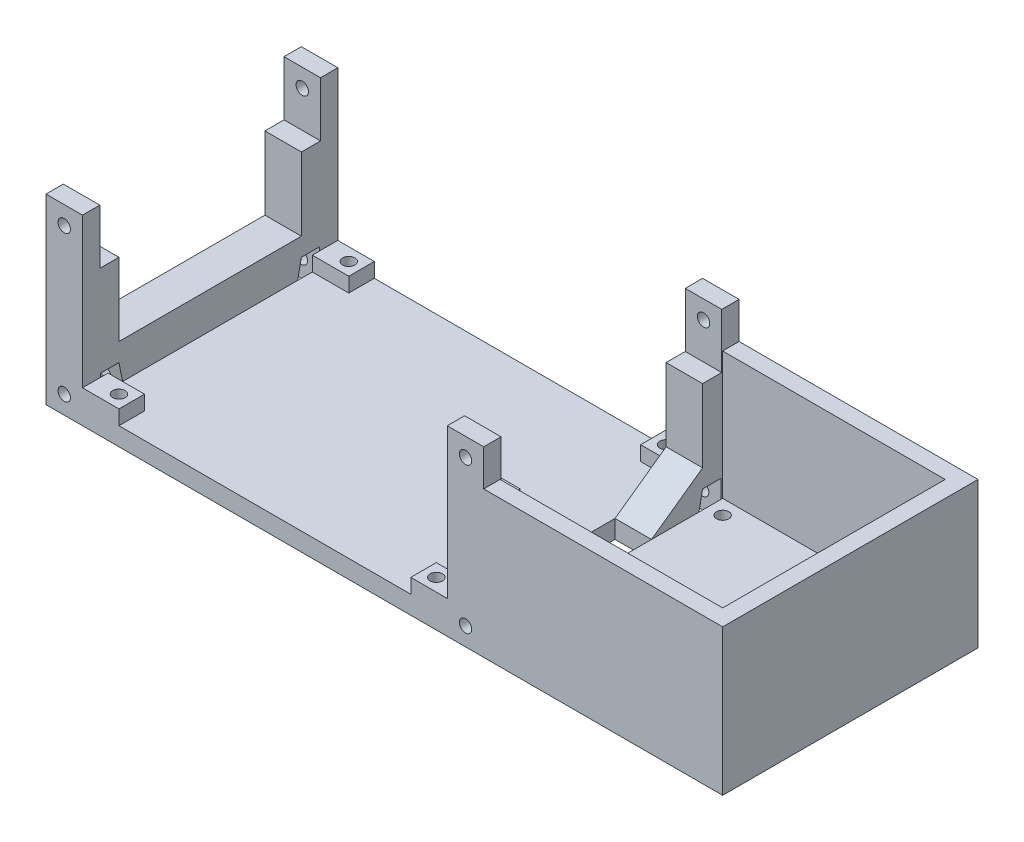
from build123d import *
from OCP.BRepFilletAPI import BRepFilletAPI_MakeChamfer

# Parameters (mm, degrees)
SKETCH1_W                = 120
SKETCH1_H                = 70
BOSS_EXTRUDE1_DEPTH      = 5
SKETCH4_W                = 10
SKETCH4_H                = 10
BOSS_EXTRUDE2_DEPTH      = 30
SKETCH5_W                = 10
SKETCH5_H                = 5
CUT_EXTRUDE2_DEPTH       = 10
SKETCH8_W                = 10
SKETCH8_H                = 7
BOSS_EXTRUDE5_DEPTH      = 4
M3_CLEARANCE_HOLE2_D     = 3.4
M3_CLEARANCE_HOLE2_DEPTH = 65
M3_CLEARANCE_HOLE2_TIP   = 1.021463052
SKETCH12_W               = 65.5
SKETCH12_H               = 70
BOSS_EXTRUDE6_DEPTH      = 5
BOSS_EXTRUDE7_DEPTH      = 35
M3_CLEARANCE_HOLE3_D     = 3.4
M3_CLEARANCE_HOLE3_DEPTH = 65
M3_CLEARANCE_HOLE3_TIP   = 1.021463052
SKETCH24_W               = 10
SKETCH24_H               = 50
BOSS_EXTRUDE10_DEPTH     = 10
SKETCH16_W               = 10
SKETCH16_H               = 22
CUT_EXTRUDE5_DEPTH       = 133.665933834
SKETCH22_R               = 1.7
CUT_EXTRUDE7_DEPTH       = 20
CHAMFER2_SIZE            = 10
CHAMFER2_SIZE_2          = 14
SKETCH25_W               = 5.49
SKETCH25_H               = 3
CUT_EXTRUDE8_DEPTH       = 8
CUT_EXTRUDE9_START       = -20
SKETCH26_R               = 1.7
CUT_EXTRUDE9_DEPTH       = 20
CUT_EXTRUDE11_DEPTH      = 10
LPATTERN1_COUNT          = 2
LPATTERN1_PITCH          = 110
SKETCH29_W               = 10
SKETCH29_H               = 4.75
BOSS_EXTRUDE11_DEPTH     = 15
SKETCH31_R               = 1.7
CUT_EXTRUDE13_DEPTH      = 153.152062096


with BuildPart() as part:
    # Sketch1 → Boss-Extrude1 (new body)
    with BuildSketch(Plane(origin=(0, 0, 0), x_dir=(1, 0, 0), z_dir=(0, 1, 0))):
        Rectangle(SKETCH1_W, SKETCH1_H)
    extrude(amount=BOSS_EXTRUDE1_DEPTH)

    # Sketch4 → Boss-Extrude2 (add)
    with BuildSketch(Plane(origin=(0, 5, 0), x_dir=(1, 0, 0), z_dir=(0, 1, 0))):
        with Locations((-55, -30)):
            Rectangle(SKETCH4_W, SKETCH4_H)
        with Locations((-55, 30)):
            Rectangle(SKETCH4_W, SKETCH4_H)
        with Locations((55, -30)):
            Rectangle(SKETCH4_W, SKETCH4_H)
        with Locations((55, 30)):
            Rectangle(SKETCH4_W, SKETCH4_H)
    extrude(amount=BOSS_EXTRUDE2_DEPTH)

    # Sketch5 → Cut-Extrude2 (cut)
    with BuildSketch(Plane.XZ):
        with Locations((-55, -27.5)):
            Rectangle(SKETCH5_W, SKETCH5_H)
        with Locations((-55, 27.5)):
            Rectangle(SKETCH5_W, SKETCH5_H)
        with Locations((55, 27.5)):
            Rectangle(SKETCH5_W, SKETCH5_H)
        with Locations((55, -27.5)):
            Rectangle(SKETCH5_W, SKETCH5_H)
    extrude(amount=-CUT_EXTRUDE2_DEPTH, mode=Mode.SUBTRACT)

    # Sketch8 → Boss-Extrude5 (add)
    with BuildSketch(Plane(origin=(0, 5, 0), x_dir=(1, 0, 0), z_dir=(0, 1, 0))):
        with Locations((-45, 31.5)):
            Rectangle(SKETCH8_W, SKETCH8_H)
        with Locations((-45, -31.5)):
            Rectangle(SKETCH8_W, SKETCH8_H)
        with Locations((45, -31.5)):
            Rectangle(SKETCH8_W, SKETCH8_H)
        with Locations((45, 31.5)):
            Rectangle(SKETCH8_W, SKETCH8_H)
    extrude(amount=BOSS_EXTRUDE5_DEPTH)

    # M3 Clearance Hole2
    with Locations(Plane(origin=(0, 9, 0), x_dir=(1, 0, 0), z_dir=(0, 1, 0))):
        with Locations((-43.5, -31.5), (-43.5, 31.5), (43.5, 31.5), (43.5, -31.5)):
            Hole(M3_CLEARANCE_HOLE2_D / 2, depth=M3_CLEARANCE_HOLE2_DEPTH)
            with Locations((0, 0, -(M3_CLEARANCE_HOLE2_DEPTH + M3_CLEARANCE_HOLE2_TIP / 2))):  # 118° drill point
                Cone(0, M3_CLEARANCE_HOLE2_D / 2, M3_CLEARANCE_HOLE2_TIP, mode=Mode.SUBTRACT)

    # Sketch12 → Boss-Extrude6 (add)
    with BuildSketch(Plane.XZ):
        with Locations((92.75, 0)):
            Rectangle(SKETCH12_W, SKETCH12_H)
    extrude(amount=-BOSS_EXTRUDE6_DEPTH)

    # Sketch13 → Boss-Extrude7 (add)
    with BuildSketch(Plane(origin=(0, 5, 0), x_dir=(1, 0, 0), z_dir=(0, 1, 0))):
        Polygon((60, 35), (125.5, 35), (125.5, -35), (60, -35), (60, -30.5), (121, -30.5), (121, 30.5), (60, 30.5), align=None)
    extrude(amount=BOSS_EXTRUDE7_DEPTH)

    # M3 Clearance Hole3
    with Locations(Plane(origin=(0, 5, 0), x_dir=(1, 0, 0), z_dir=(0, 1, 0))):
        with Locations((117, -26.5), (117, 26.5), (64, 26.5), (64, -26.5)):
            Hole(M3_CLEARANCE_HOLE3_D / 2, depth=M3_CLEARANCE_HOLE3_DEPTH)
            with Locations((0, 0, -(M3_CLEARANCE_HOLE3_DEPTH + M3_CLEARANCE_HOLE3_TIP / 2))):  # 118° drill point
                Cone(0, M3_CLEARANCE_HOLE3_D / 2, M3_CLEARANCE_HOLE3_TIP, mode=Mode.SUBTRACT)

    # Sketch24 → Boss-Extrude10 (add)
    with BuildSketch(Plane(origin=(0, 5, 0), x_dir=(1, 0, 0), z_dir=(0, 1, 0))):
        with Locations((-55, 0)):
            Rectangle(SKETCH24_W, SKETCH24_H)
        with Locations((55, 0)):
            Rectangle(SKETCH24_W, SKETCH24_H)
    extrude(amount=BOSS_EXTRUDE10_DEPTH)

    # Sketch16 → Cut-Extrude5 (cut, through all)
    with BuildSketch(Plane(origin=(0, 15, 0), x_dir=(1, 0, 0), z_dir=(0, 1, 0))):
        with Locations((55, 0)):
            Rectangle(SKETCH16_W, SKETCH16_H)
    extrude(amount=-CUT_EXTRUDE5_DEPTH, mode=Mode.SUBTRACT)

    # Sketch22 → Cut-Extrude7 (cut)
    with BuildSketch(Plane.XY.offset(35)):
        with Locations((-55, 5)):
            Circle(SKETCH22_R)
        with Locations((55, 5)):
            Circle(SKETCH22_R)
    extrude(amount=-CUT_EXTRUDE7_DEPTH, mode=Mode.SUBTRACT)

    # Chamfer2
    chamfer2_edges_1 = [part.edges().sort_by_distance(p)[0] for p in [
        (55, 15, 11),
    ]]
    chamfer2_side_1 = [part.faces().sort_by_distance(p)[0] for p in [
        (55, 14.8, 11),
    ]]
    chamfer2_edges_2 = [part.edges().sort_by_distance(p)[0] for p in [
        (55, 15, -11),
    ]]
    chamfer2_side_2 = [part.faces().sort_by_distance(p)[0] for p in [
        (55, 14.8, -11),
    ]]
    chamfer2 = BRepFilletAPI_MakeChamfer(part.part.solid().wrapped)
    for e in chamfer2_edges_1:
        chamfer2.Add(CHAMFER2_SIZE - 0.0001, CHAMFER2_SIZE_2 - 0.0001, e.wrapped, chamfer2_side_1[0].wrapped)
    for e in chamfer2_edges_2:
        chamfer2.Add(CHAMFER2_SIZE - 0.0001, CHAMFER2_SIZE_2 - 0.0001, e.wrapped, chamfer2_side_2[0].wrapped)
    add(Compound.cast(chamfer2.Shape()), mode=Mode.REPLACE)  # a hair under: the kernel refuses the full size

    # Sketch25 → Cut-Extrude8 (cut)
    with BuildSketch(Plane.XZ):
        with Locations((-55, -18.5)):
            Rectangle(SKETCH25_W, SKETCH25_H)
        with Locations((55, -18.5)):
            Rectangle(SKETCH25_W, SKETCH25_H)
        with Locations((55, 18.5)):
            Rectangle(SKETCH25_W, SKETCH25_H)
        with Locations((-55, 18.5)):
            Rectangle(SKETCH25_W, SKETCH25_H)
    extrude(amount=-CUT_EXTRUDE8_DEPTH, mode=Mode.SUBTRACT)

    # Sketch26 → Cut-Extrude9 (cut)
    with BuildSketch(Plane(origin=(0, 0, -35), x_dir=(-1, 0, 0), z_dir=(0, 0, -1)).offset(CUT_EXTRUDE9_START)):
        with Locations(Location((-55, 5, 0), (0, 0, 180))):
            Circle(SKETCH26_R)
        with Locations(Location((55, 5, 0), (0, 0, 180))):
            Circle(SKETCH26_R)
    extrude(amount=CUT_EXTRUDE9_DEPTH, mode=Mode.SUBTRACT)

    # Sketch28 → Cut-Extrude11 (cut)
    with BuildSketch(Plane.ZY.offset(60)):
        Polygon((-25, 10), (-23, 0), (-25, 0), align=None)
        Polygon((25, 10), (23, 0), (25, 0), align=None)
    cut_extrude11 = extrude(amount=-CUT_EXTRUDE11_DEPTH, mode=Mode.SUBTRACT)

    # LPattern1: Cut-Extrude11 ×2
    with Locations(*[(i * LPATTERN1_PITCH, 0, 0) for i in range(1, LPATTERN1_COUNT)]):
        add(cut_extrude11, mode=Mode.SUBTRACT)

    # Sketch29 → Boss-Extrude11 (add)
    with BuildSketch(Plane(origin=(0, 35, 0), x_dir=(1, 0, 0), z_dir=(0, 1, 0))):
        with Locations((55, 32.625)):
            Rectangle(SKETCH29_W, SKETCH29_H)
        with Locations((55, -32.625)):
            Rectangle(SKETCH29_W, SKETCH29_H)
        with Locations((-55, 32.625)):
            Rectangle(SKETCH29_W, SKETCH29_H)
        with Locations((-55, -32.625)):
            Rectangle(SKETCH29_W, SKETCH29_H)
    extrude(amount=BOSS_EXTRUDE11_DEPTH)

    # Sketch31 → Cut-Extrude13 (cut, through all)
    with BuildSketch(Plane(origin=(0, 0, -35), x_dir=(-1, 0, 0), z_dir=(0, 0, -1))):
        with Locations((-55, 45)):
            Circle(SKETCH31_R)
        with Locations((55, 45)):
            Circle(SKETCH31_R)
    extrude(amount=-CUT_EXTRUDE13_DEPTH, mode=Mode.SUBTRACT)


solid = part.part
